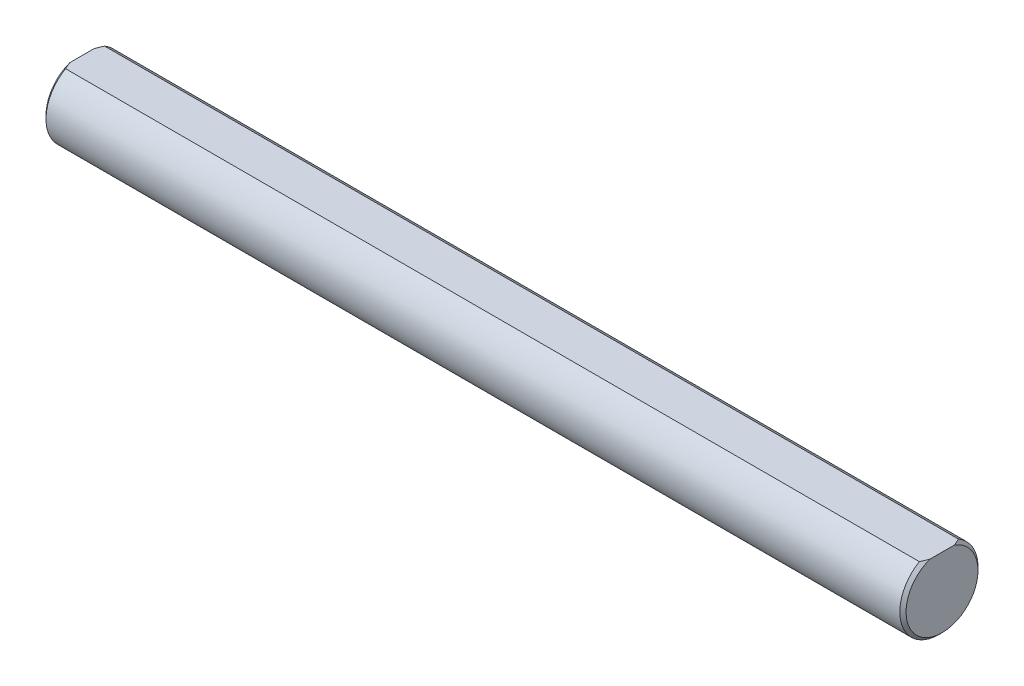
from build123d import *

# Parameters (mm, degrees)
SKETCH1_R           = 3.175
BOSS_EXTRUDE1_DEPTH = 69.85
CHAMFER1_SIZE       = 0.254
CUT_EXTRUDE2_DEPTH  = 70.9941694


with BuildPart() as part:
    # Sketch1 → Boss-Extrude1 (new body)
    with BuildSketch(Plane(origin=(0, 0, 0), x_dir=(0, 0, -1), z_dir=(1, 0, 0))):
        Circle(SKETCH1_R)
    extrude(amount=BOSS_EXTRUDE1_DEPTH)

    # Chamfer1
    chamfer1_edges = [part.edges().sort_by_distance(p)[0] for p in [
        (69.85, 0, 3.175),
        (0, 0, 3.175),
    ]]
    chamfer(chamfer1_edges, length=CHAMFER1_SIZE)

    # Sketch2 → Cut-Extrude2 (cut, through all)
    with BuildSketch(Plane(origin=(69.85, 0, 0), x_dir=(0, 0, -1), z_dir=(1, 0, 0))):
        with BuildLine():
            Line((-1.5875, 2.749630657), (1.5875, 2.749630657))
            ThreePointArc((1.5875, 2.749630657), (0, 3.175), (-1.5875, 2.749630657))
        make_face()
    extrude(amount=-CUT_EXTRUDE2_DEPTH, mode=Mode.SUBTRACT)


solid = part.part
